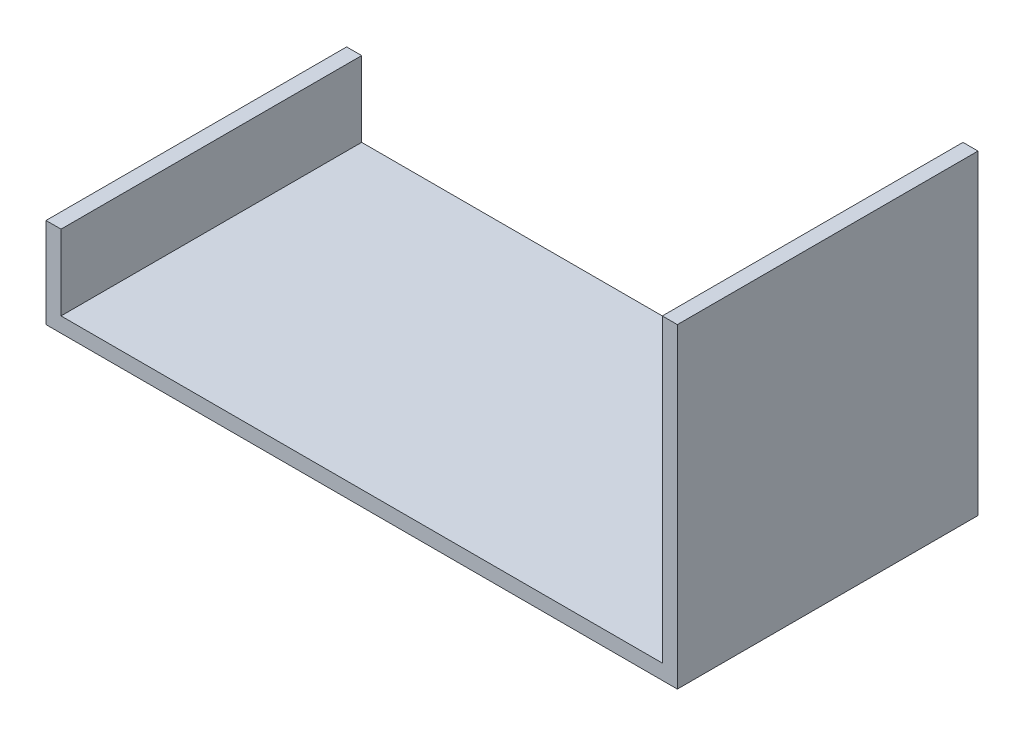
from build123d import *

# Parameters (mm, degrees)
EXTRUDE_1_DEPTH = 40


with BuildPart() as part:
    # 草图1 → 凸台-拉伸1 (new body)
    with BuildSketch(Plane.XY):
        Polygon((-46.573046286, 28.58525296), (-46.573046286, 18.58525296), (33.426953714, 18.58525296), (33.426953714, 58.58525296), (35.426953714, 58.58525296), (35.426953714, 16.58525296), (-48.573046286, 16.58525296), (-48.573046286, 28.58525296), align=None)
    extrude(amount=EXTRUDE_1_DEPTH)


solid = part.part
